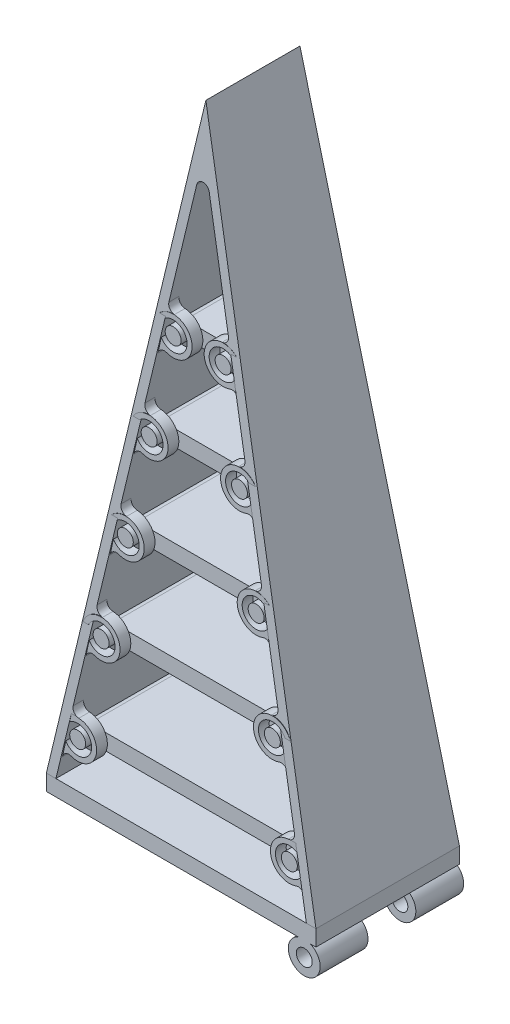
from build123d import *
from build123d.topology import SkipClean

# Parameters (mm, degrees)
AUFSATZ_LINEAR_AUSTRAGEN4_DEPTH  = 18
SCHNITT_LINEAR_START             = -33.911149
SCHNITT_LINEAR_AUSTRAGEN1_DEPTH  = 33.822298
AUFSATZ_LINEAR_START             = -5.37
AUFSATZ_LINEAR_AUSTRAGEN5_DEPTH  = 10.74
AUFSATZ_LINEAR_START_2           = -5.85
AUFSATZ_LINEAR_AUSTRAGEN6_DEPTH  = 11.7
AUFSATZ_LINEAR_START_3           = -6.3
AUFSATZ_LINEAR_AUSTRAGEN7_DEPTH  = 12.6
AUFSATZ_LINEAR_START_4           = -6.8
AUFSATZ_LINEAR_AUSTRAGEN8_DEPTH  = 13.6
AUFSATZ_LINEAR_START_5           = -7.2
AUFSATZ_LINEAR_AUSTRAGEN9_DEPTH  = 14.4
SKIZZE13_R                       = 1
AUFSATZ_LINEAR_AUSTRAGEN12_DEPTH = 1.5
SKIZZE14_R                       = 1
AUFSATZ_LINEAR_AUSTRAGEN13_DEPTH = 1.5
SKIZZE15_R                       = 1
AUFSATZ_LINEAR_AUSTRAGEN14_DEPTH = 1.5
SKIZZE16_R                       = 1
AUFSATZ_LINEAR_AUSTRAGEN15_DEPTH = 1.5
SKIZZE17_R                       = 1
AUFSATZ_LINEAR_AUSTRAGEN16_DEPTH = 1.5
SKIZZE18_R                       = 1
AUFSATZ_LINEAR_AUSTRAGEN17_DEPTH = 1.5
SKIZZE19_R                       = 1
AUFSATZ_LINEAR_AUSTRAGEN18_DEPTH = 1.5
SKIZZE20_R                       = 1
AUFSATZ_LINEAR_AUSTRAGEN19_DEPTH = 1.5
SKIZZE21_R                       = 1
AUFSATZ_LINEAR_AUSTRAGEN20_DEPTH = 1.5
SKIZZE22_R                       = 1
AUFSATZ_LINEAR_AUSTRAGEN21_DEPTH = 1.5
AUFSATZ_LINEAR_START_6           = -1.35
SKIZZE24_R                       = 2.375
SKIZZE24_R_2                     = 1.75
AUFSATZ_LINEAR_AUSTRAGEN22_DEPTH = 1.35
SKIZZE25_R                       = 2.375
SKIZZE25_R_2                     = 1.75
AUFSATZ_LINEAR_AUSTRAGEN23_DEPTH = 1.35
SKIZZE26_R                       = 2.375
SKIZZE26_R_2                     = 1.75
AUFSATZ_LINEAR_AUSTRAGEN24_DEPTH = 1.35
SKIZZE27_R                       = 2.375
SKIZZE27_R_2                     = 1.75
AUFSATZ_LINEAR_AUSTRAGEN25_DEPTH = 1.35
SKIZZE28_R                       = 2.375
SKIZZE28_R_2                     = 1.75
AUFSATZ_LINEAR_AUSTRAGEN26_DEPTH = 1.35
SKIZZE29_R                       = 2.375
SKIZZE29_R_2                     = 1.75
AUFSATZ_LINEAR_AUSTRAGEN27_DEPTH = 1.35
SKIZZE30_R                       = 2.375
SKIZZE30_R_2                     = 1.75
AUFSATZ_LINEAR_AUSTRAGEN28_DEPTH = 1.35
SKIZZE31_R                       = 2.375
SKIZZE31_R_2                     = 1.75
AUFSATZ_LINEAR_AUSTRAGEN29_DEPTH = 1.35
SKIZZE32_R                       = 2.375
SKIZZE32_R_2                     = 1.75
AUFSATZ_LINEAR_AUSTRAGEN30_DEPTH = 1.35
SKIZZE33_R                       = 2.375
SKIZZE33_R_2                     = 1.75
AUFSATZ_LINEAR_AUSTRAGEN31_DEPTH = 1.35
VERRUNDUNG1_R                    = 0.8
VERRUNDUNG2_R                    = 0.8
AUFSATZ_LINEAR_AUSTRAGEN32_DEPTH = 2
AUFSATZ_LINEAR_START_7           = -18
SKIZZE38_R                       = 2
AUFSATZ_LINEAR_AUSTRAGEN33_DEPTH = 18
SKIZZE39_R                       = 1
SCHNITT_LINEAR_AUSTRAGEN2_DEPTH  = 18
SCHNITT_LINEAR_START_2           = -12
SKIZZE40_R                       = 2
SCHNITT_LINEAR_AUSTRAGEN3_DEPTH  = 6


with BuildPart() as part:
    # Skizze1 → Aufsatz-Linear austragen4 (new body)
    with BuildSketch(Plane.XY):
        Polygon((0, 0), (16.911148858, -80), (15.711148858, -80), (0, -5.676728459), (-15.711148858, -80), (-16.911148858, -80), align=None)
    extrude(amount=AUFSATZ_LINEAR_AUSTRAGEN4_DEPTH)

    # Skizze11 → Schnitt-Linear austragen1 (cut)
    with BuildSketch(Plane(origin=(17, 0, 0), x_dir=(0, 0, -1), z_dir=(1, 0, 0)).offset(SCHNITT_LINEAR_START)):
        Polygon((-18, -80), (-14.9, 0), (-18, 0), align=None)
        Polygon((0, -80), (-3.1, 0), (0, 0), align=None)
    extrude(amount=SCHNITT_LINEAR_AUSTRAGEN1_DEPTH, mode=Mode.SUBTRACT)

    # Skizze24 → Aufsatz-Linear austragen22 (add)
    # profile 1 of 2: a face of its own
    with BuildSketch(Plane.XY.offset(15.87).offset(AUFSATZ_LINEAR_START_6)):
        with Locations((-3.132547008, -26.676728459)):
            Circle(SKIZZE24_R)
        with Locations((-3.132547008, -26.676728459)):
            Circle(SKIZZE24_R_2, mode=Mode.SUBTRACT)
    # profile 2 of 2: a face of its own
    with BuildSketch(Plane.XY.offset(15.87).offset(AUFSATZ_LINEAR_START_6)):
        with Locations((3.132547008, -26.676728459)):
            Circle(SKIZZE24_R)
        with Locations((3.132547008, -26.676728459)):
            Circle(SKIZZE24_R_2, mode=Mode.SUBTRACT)
    extrude(amount=AUFSATZ_LINEAR_AUSTRAGEN22_DEPTH)

    # Skizze25 → Aufsatz-Linear austragen23 (add)
    # profile 1 of 2: a face of its own
    with BuildSketch(Plane.XY.offset(16.35).offset(AUFSATZ_LINEAR_START_6)):
        with Locations((-5.669219336, -38.676728459)):
            Circle(SKIZZE25_R)
        with Locations((-5.669219336, -38.676728459)):
            Circle(SKIZZE25_R_2, mode=Mode.SUBTRACT)
    # profile 2 of 2: a face of its own
    with BuildSketch(Plane.XY.offset(16.35).offset(AUFSATZ_LINEAR_START_6)):
        with Locations((5.669219336, -38.676728459)):
            Circle(SKIZZE25_R)
        with Locations((5.669219336, -38.676728459)):
            Circle(SKIZZE25_R_2, mode=Mode.SUBTRACT)
    extrude(amount=AUFSATZ_LINEAR_AUSTRAGEN23_DEPTH)

    # Skizze26 → Aufsatz-Linear austragen24 (add)
    # profile 1 of 2: a face of its own
    with BuildSketch(Plane.XY.offset(16.8).offset(AUFSATZ_LINEAR_START_6)):
        with Locations((-8.205891665, -50.676728459)):
            Circle(SKIZZE26_R)
        with Locations((-8.205891665, -50.676728459)):
            Circle(SKIZZE26_R_2, mode=Mode.SUBTRACT)
    # profile 2 of 2: a face of its own
    with BuildSketch(Plane.XY.offset(16.8).offset(AUFSATZ_LINEAR_START_6)):
        with Locations((8.205891665, -50.676728459)):
            Circle(SKIZZE26_R)
        with Locations((8.205891665, -50.676728459)):
            Circle(SKIZZE26_R_2, mode=Mode.SUBTRACT)
    extrude(amount=AUFSATZ_LINEAR_AUSTRAGEN24_DEPTH)

    # Skizze27 → Aufsatz-Linear austragen25 (add)
    # profile 1 of 2: a face of its own
    with BuildSketch(Plane.XY.offset(17.3).offset(AUFSATZ_LINEAR_START_6)):
        with Locations((-10.742563994, -62.676728459)):
            Circle(SKIZZE27_R)
        with Locations((-10.742563994, -62.676728459)):
            Circle(SKIZZE27_R_2, mode=Mode.SUBTRACT)
    # profile 2 of 2: a face of its own
    with BuildSketch(Plane.XY.offset(17.3).offset(AUFSATZ_LINEAR_START_6)):
        with Locations((10.742563994, -62.676728459)):
            Circle(SKIZZE27_R)
        with Locations((10.742563994, -62.676728459)):
            Circle(SKIZZE27_R_2, mode=Mode.SUBTRACT)
    extrude(amount=AUFSATZ_LINEAR_AUSTRAGEN25_DEPTH)

    # Skizze28 → Aufsatz-Linear austragen26 (add)
    # profile 1 of 2: a face of its own
    with BuildSketch(Plane.XY.offset(17.7).offset(AUFSATZ_LINEAR_START_6)):
        with Locations((-13.279236322, -74.676728459)):
            Circle(SKIZZE28_R)
        with Locations((-13.279236322, -74.676728459)):
            Circle(SKIZZE28_R_2, mode=Mode.SUBTRACT)
    # profile 2 of 2: a face of its own
    with BuildSketch(Plane.XY.offset(17.7).offset(AUFSATZ_LINEAR_START_6)):
        with Locations((13.279236322, -74.676728459)):
            Circle(SKIZZE28_R)
        with Locations((13.279236322, -74.676728459)):
            Circle(SKIZZE28_R_2, mode=Mode.SUBTRACT)
    extrude(amount=AUFSATZ_LINEAR_AUSTRAGEN26_DEPTH)

    # Skizze29 → Aufsatz-Linear austragen27 (add)
    # profile 1 of 2: a face of its own
    with BuildSketch(Plane(origin=(0, 0, 2.13), x_dir=(-1, 0, 0), z_dir=(0, 0, -1)).offset(AUFSATZ_LINEAR_START_6)):
        with Locations((-3.132547008, -26.676728459)):
            Circle(SKIZZE29_R)
        with Locations((-3.132547008, -26.676728459)):
            Circle(SKIZZE29_R_2, mode=Mode.SUBTRACT)
    # profile 2 of 2: a face of its own
    with BuildSketch(Plane(origin=(0, 0, 2.13), x_dir=(-1, 0, 0), z_dir=(0, 0, -1)).offset(AUFSATZ_LINEAR_START_6)):
        with Locations((3.132547008, -26.676728459)):
            Circle(SKIZZE29_R)
        with Locations((3.132547008, -26.676728459)):
            Circle(SKIZZE29_R_2, mode=Mode.SUBTRACT)
    extrude(amount=AUFSATZ_LINEAR_AUSTRAGEN27_DEPTH)

    # Skizze30 → Aufsatz-Linear austragen28 (add)
    # profile 1 of 2: a face of its own
    with BuildSketch(Plane(origin=(0, 0, 1.65), x_dir=(-1, 0, 0), z_dir=(0, 0, -1)).offset(AUFSATZ_LINEAR_START_6)):
        with Locations((-5.669219336, -38.676728459)):
            Circle(SKIZZE30_R)
        with Locations((-5.669219336, -38.676728459)):
            Circle(SKIZZE30_R_2, mode=Mode.SUBTRACT)
    # profile 2 of 2: a face of its own
    with BuildSketch(Plane(origin=(0, 0, 1.65), x_dir=(-1, 0, 0), z_dir=(0, 0, -1)).offset(AUFSATZ_LINEAR_START_6)):
        with Locations((5.669219336, -38.676728459)):
            Circle(SKIZZE30_R)
        with Locations((5.669219336, -38.676728459)):
            Circle(SKIZZE30_R_2, mode=Mode.SUBTRACT)
    extrude(amount=AUFSATZ_LINEAR_AUSTRAGEN28_DEPTH)

    # Skizze31 → Aufsatz-Linear austragen29 (add)
    # profile 1 of 2: a face of its own
    with BuildSketch(Plane(origin=(0, 0, 1.2), x_dir=(-1, 0, 0), z_dir=(0, 0, -1)).offset(AUFSATZ_LINEAR_START_6)):
        with Locations((-8.205891665, -50.676728459)):
            Circle(SKIZZE31_R)
        with Locations((-8.205891665, -50.676728459)):
            Circle(SKIZZE31_R_2, mode=Mode.SUBTRACT)
    # profile 2 of 2: a face of its own
    with BuildSketch(Plane(origin=(0, 0, 1.2), x_dir=(-1, 0, 0), z_dir=(0, 0, -1)).offset(AUFSATZ_LINEAR_START_6)):
        with Locations((8.205891665, -50.676728459)):
            Circle(SKIZZE31_R)
        with Locations((8.205891665, -50.676728459)):
            Circle(SKIZZE31_R_2, mode=Mode.SUBTRACT)
    extrude(amount=AUFSATZ_LINEAR_AUSTRAGEN29_DEPTH)

    # Skizze32 → Aufsatz-Linear austragen30 (add)
    # profile 1 of 2: a face of its own
    with BuildSketch(Plane(origin=(0, 0, 0.7), x_dir=(-1, 0, 0), z_dir=(0, 0, -1)).offset(AUFSATZ_LINEAR_START_6)):
        with Locations((-10.742563994, -62.676728459)):
            Circle(SKIZZE32_R)
        with Locations((-10.742563994, -62.676728459)):
            Circle(SKIZZE32_R_2, mode=Mode.SUBTRACT)
    # profile 2 of 2: a face of its own
    with BuildSketch(Plane(origin=(0, 0, 0.7), x_dir=(-1, 0, 0), z_dir=(0, 0, -1)).offset(AUFSATZ_LINEAR_START_6)):
        with Locations((10.742563994, -62.676728459)):
            Circle(SKIZZE32_R)
        with Locations((10.742563994, -62.676728459)):
            Circle(SKIZZE32_R_2, mode=Mode.SUBTRACT)
    extrude(amount=AUFSATZ_LINEAR_AUSTRAGEN30_DEPTH)

    # Skizze33 → Aufsatz-Linear austragen31 (add)
    # profile 1 of 2: a face of its own
    with BuildSketch(Plane(origin=(0, 0, 0.3), x_dir=(-1, 0, 0), z_dir=(0, 0, -1)).offset(AUFSATZ_LINEAR_START_6)):
        with Locations((-13.279236322, -74.676728459)):
            Circle(SKIZZE33_R)
        with Locations((-13.279236322, -74.676728459)):
            Circle(SKIZZE33_R_2, mode=Mode.SUBTRACT)
    # profile 2 of 2: a face of its own
    with BuildSketch(Plane(origin=(0, 0, 0.3), x_dir=(-1, 0, 0), z_dir=(0, 0, -1)).offset(AUFSATZ_LINEAR_START_6)):
        with Locations((13.279236322, -74.676728459)):
            Circle(SKIZZE33_R)
        with Locations((13.279236322, -74.676728459)):
            Circle(SKIZZE33_R_2, mode=Mode.SUBTRACT)
    extrude(amount=AUFSATZ_LINEAR_AUSTRAGEN31_DEPTH)

    # Verrundung1
    verrundung1_edges = [part.edges().sort_by_distance(p)[0] for p in [
        (0, -5.676728459, 9),
    ]]
    fillet(verrundung1_edges, radius=VERRUNDUNG1_R)

    # Verrundung2
    # the kernel refuses this fillet: 0.8 mm, written as the material it adds along each edge
    with BuildSketch(Plane(origin=(-7.333926251, -40.370651683, 16.35), x_dir=(-0.20681895998091412, -0.9783792300495822, 0), z_dir=(0, 0, -1)), Plane(origin=(-9.87059858, -52.370651683, 16.8), x_dir=(-0.20681895998091412, -0.9783792300495822, 0), z_dir=(0, 0, -1)), Plane(origin=(-12.407270908, -64.370651683, 17.3), x_dir=(-0.2068189599809156, -0.9783792300495817, 0), z_dir=(0, 0, -1)), Plane(origin=(-14.943943237, -76.370651683, 17.7), x_dir=(-0.2068189599809131, -0.9783792300495824, 0), z_dir=(0, 0, -1)), Plane(origin=(4.797253922, -28.370651683, 2.13), x_dir=(0.20681895998091462, -0.9783792300495819, 0), z_dir=(0, 0, 1)), Plane(origin=(7.333926251, -40.370651683, 1.65), x_dir=(0.20681895998091462, -0.9783792300495819, 0), z_dir=(0, 0, 1)), Plane(origin=(9.87059858, -52.370651683, 1.2), x_dir=(0.20681895998091412, -0.9783792300495822, 0), z_dir=(0, 0, 1)), Plane(origin=(12.407270908, -64.370651683, 0.7), x_dir=(0.20681895998091412, -0.9783792300495822, 0), z_dir=(0, 0, 1)), Plane(origin=(14.943943237, -76.370651683, 0.3), x_dir=(0.20681895998091113, -0.9783792300495827, 0), z_dir=(0, 0, 1)), Plane(origin=(-4.797253922, -28.370651683, 15.87), x_dir=(-0.20681895998091177, -0.9783792300495826, 0), z_dir=(0, 0, -1))) as verrundung2_piece_1:
        with BuildLine():
            CenterArc((1.137162009, -0.8), VERRUNDUNG2_R, 90, 98.665792169)
            ThreePointArc((0.346294794, -0.920536499), (0.221320117, -0.44214625), (0, 0))
            Line((0, 0), (1.137162009, 0))
        make_face()
    extrude(amount=1.35)
    with BuildSketch(Plane(origin=(-6.505991795, -36.45401911, 19.155498263), x_dir=(0.20681895998091263, 0.9783792300495825, 0), z_dir=(0, 0, -1))) as verrundung2_piece_2_section:
        with BuildLine():
            CenterArc((1.137162009, 0.8), VERRUNDUNG2_R, 171.334207831, 98.665792169)
            ThreePointArc((0.346294794, 0.920536499), (0.221320117, 0.44214625), (0, 0))
            Line((0, 0), (1.137162009, 0))
        make_face()
    verrundung2_piece_2 = extrude(amount=4.155498263, mode=Mode.PRIVATE)
    verrundung2_piece_2 = split(verrundung2_piece_2, bisect_by=Plane(origin=(-6.217215771, -36.095589606, 16.298704097), z_dir=(0, -0.03872093994908253, -0.9992500632021294)), keep=Keep.TOP, mode=Mode.PRIVATE)
    add(verrundung2_piece_2)
    with BuildSketch(Plane(origin=(7.333926251, -40.370651683, 16.35), x_dir=(0.20681895998091462, -0.9783792300495819, 0), z_dir=(0, 0, -1)), Plane(origin=(9.87059858, -52.370651683, 16.8), x_dir=(0.20681895998091263, -0.9783792300495825, 0), z_dir=(0, 0, -1)), Plane(origin=(12.407270908, -64.370651683, 17.3), x_dir=(0.20681895998091412, -0.9783792300495822, 0), z_dir=(0, 0, -1)), Plane(origin=(14.943943237, -76.370651683, 17.7), x_dir=(0.20681895998090907, -0.9783792300495833, 0), z_dir=(0, 0, -1)), Plane(origin=(-4.797253922, -28.370651683, 2.13), x_dir=(-0.20681895998091113, -0.9783792300495827, 0), z_dir=(0, 0, 1)), Plane(origin=(-7.333926251, -40.370651683, 1.65), x_dir=(-0.2068189599809139, -0.9783792300495822, 0), z_dir=(0, 0, 1)), Plane(origin=(-9.87059858, -52.370651683, 1.2), x_dir=(-0.20681895998091412, -0.9783792300495822, 0), z_dir=(0, 0, 1)), Plane(origin=(-12.407270908, -64.370651683, 0.7), x_dir=(-0.20681895998091412, -0.9783792300495822, 0), z_dir=(0, 0, 1)), Plane(origin=(-14.943943237, -76.370651683, 0.3), x_dir=(-0.2068189599809131, -0.9783792300495824, 0), z_dir=(0, 0, 1)), Plane(origin=(4.797253922, -28.370651683, 15.87), x_dir=(0.20681895998091462, -0.9783792300495819, 0), z_dir=(0, 0, -1))) as verrundung2_piece_3:
        with BuildLine():
            CenterArc((1.137162009, 0.8), VERRUNDUNG2_R, 171.334207831, 98.665792169)
            ThreePointArc((0.346294794, 0.920536499), (0.221320117, 0.44214625), (0, 0))
            Line((0, 0), (1.137162009, 0))
        make_face()
    extrude(amount=1.35)
    with BuildSketch(Plane(origin=(6.505991795, -36.45401911, 19.155498263), x_dir=(-0.20681895998091412, 0.9783792300495822, 0), z_dir=(0, 0, -1))) as verrundung2_piece_4_section:
        with BuildLine():
            CenterArc((1.137162009, -0.8), VERRUNDUNG2_R, 90, 98.665792169)
            ThreePointArc((0.346294794, -0.920536499), (0.221320117, -0.44214625), (0, 0))
            Line((0, 0), (1.137162009, 0))
        make_face()
    verrundung2_piece_4 = extrude(amount=4.155498263, mode=Mode.PRIVATE)
    verrundung2_piece_4 = split(verrundung2_piece_4, bisect_by=Plane(origin=(6.217215771, -36.095589606, 16.298704097), z_dir=(0, -0.03872093994908253, -0.9992500632021294)), keep=Keep.TOP, mode=Mode.PRIVATE)
    add(verrundung2_piece_4)
    with BuildSketch(Plane(origin=(-9.042664124, -48.45401911, 19.620498263), x_dir=(0.20681895998091263, 0.9783792300495825, 0), z_dir=(0, 0, -1))) as verrundung2_piece_5_section:
        with BuildLine():
            CenterArc((1.137162009, 0.8), VERRUNDUNG2_R, 171.334207831, 98.665792169)
            ThreePointArc((0.346294794, 0.920536499), (0.221320117, 0.44214625), (0, 0))
            Line((0, 0), (1.137162009, 0))
        make_face()
    verrundung2_piece_5 = extrude(amount=4.170498263, mode=Mode.PRIVATE)
    verrundung2_piece_5 = split(verrundung2_piece_5, bisect_by=Plane(origin=(-8.753891259, -48.095283689, 16.763692243), z_dir=(0, -0.03872093994908253, -0.9992500632021294)), keep=Keep.TOP, mode=Mode.PRIVATE)
    add(verrundung2_piece_5)
    with BuildSketch(Plane(origin=(9.042664124, -48.45401911, 19.620498263), x_dir=(-0.20681895998091412, 0.9783792300495822, 0), z_dir=(0, 0, -1))) as verrundung2_piece_6_section:
        with BuildLine():
            CenterArc((1.137162009, -0.8), VERRUNDUNG2_R, 90, 98.665792169)
            ThreePointArc((0.346294794, -0.920536499), (0.221320117, -0.44214625), (0, 0))
            Line((0, 0), (1.137162009, 0))
        make_face()
    verrundung2_piece_6 = extrude(amount=4.170498263, mode=Mode.PRIVATE)
    verrundung2_piece_6 = split(verrundung2_piece_6, bisect_by=Plane(origin=(8.753891259, -48.095283689, 16.763692243), z_dir=(0, -0.03872093994908253, -0.9992500632021294)), keep=Keep.TOP, mode=Mode.PRIVATE)
    add(verrundung2_piece_6)
    with BuildSketch(Plane(origin=(-11.579336453, -60.45401911, 20.085498263), x_dir=(0.20681895998091412, 0.9783792300495822, 0), z_dir=(0, 0, -1))) as verrundung2_piece_7_section:
        with BuildLine():
            CenterArc((1.137162009, 0.8), VERRUNDUNG2_R, 171.334207831, 98.665792169)
            ThreePointArc((0.346294794, 0.920536499), (0.221320117, 0.44214625), (0, 0))
            Line((0, 0), (1.137162009, 0))
        make_face()
    verrundung2_piece_7 = extrude(amount=4.135498263, mode=Mode.PRIVATE)
    verrundung2_piece_7 = split(verrundung2_piece_7, bisect_by=Plane(origin=(-11.290556099, -60.095998069, 17.228719925), z_dir=(0, -0.03872093994908253, -0.9992500632021294)), keep=Keep.TOP, mode=Mode.PRIVATE)
    add(verrundung2_piece_7)
    with BuildSketch(Plane(origin=(11.579336453, -60.45401911, 20.085498263), x_dir=(-0.20681895998091435, 0.978379230049582, 0), z_dir=(0, 0, -1))) as verrundung2_piece_8_section:
        with BuildLine():
            CenterArc((1.137162009, -0.8), VERRUNDUNG2_R, 90, 98.665792169)
            ThreePointArc((0.346294794, -0.920536499), (0.221320117, -0.44214625), (0, 0))
            Line((0, 0), (1.137162009, 0))
        make_face()
    verrundung2_piece_8 = extrude(amount=4.135498263, mode=Mode.PRIVATE)
    verrundung2_piece_8 = split(verrundung2_piece_8, bisect_by=Plane(origin=(11.290556099, -60.095998069, 17.228719925), z_dir=(0, -0.03872093994908253, -0.9992500632021294)), keep=Keep.TOP, mode=Mode.PRIVATE)
    add(verrundung2_piece_8)
    with BuildSketch(Plane(origin=(-14.116008781, -72.45401911, 17.7), x_dir=(0.20681895998091412, 0.9783792300495822, 0), z_dir=(0, 0, -1))) as verrundung2_piece_9_section:
        with BuildLine():
            CenterArc((1.137162009, 0.8), VERRUNDUNG2_R, 171.334207831, 98.665792169)
            ThreePointArc((0.346294794, 0.920536499), (0.221320117, 0.44214625), (0, 0))
            Line((0, 0), (1.137162009, 0))
        make_face()
    verrundung2_piece_9 = extrude(amount=1.35, mode=Mode.PRIVATE)
    verrundung2_piece_9 = split(verrundung2_piece_9, bisect_by=Plane(origin=(-13.827218085, -72.094512866, 17.693662374), z_dir=(0, -0.03872093994908253, -0.9992500632021294)), keep=Keep.TOP, mode=Mode.PRIVATE)
    add(verrundung2_piece_9)
    with BuildSketch(Plane(origin=(14.116008781, -72.45401911, 17.7), x_dir=(-0.20681895998091662, 0.9783792300495815, 0), z_dir=(0, 0, -1))) as verrundung2_piece_10_section:
        with BuildLine():
            CenterArc((1.137162009, -0.8), VERRUNDUNG2_R, 90, 98.665792169)
            ThreePointArc((0.346294794, -0.920536499), (0.221320117, -0.44214625), (0, 0))
            Line((0, 0), (1.137162009, 0))
        make_face()
    verrundung2_piece_10 = extrude(amount=1.35, mode=Mode.PRIVATE)
    verrundung2_piece_10 = split(verrundung2_piece_10, bisect_by=Plane(origin=(13.827218085, -72.094512866, 17.693662374), z_dir=(0, -0.03872093994908253, -0.9992500632021294)), keep=Keep.TOP, mode=Mode.PRIVATE)
    add(verrundung2_piece_10)
    with BuildSketch(Plane(origin=(3.969319467, -24.45401911, -0.690498263), x_dir=(-0.20681895998091412, 0.9783792300495822, 0), z_dir=(0, 0, 1))) as verrundung2_piece_11_section:
        with BuildLine():
            CenterArc((1.137162009, 0.8), VERRUNDUNG2_R, 171.334207831, 98.665792169)
            ThreePointArc((0.346294794, 0.920536499), (0.221320117, 0.44214625), (0, 0))
            Line((0, 0), (1.137162009, 0))
        make_face()
    verrundung2_piece_11 = extrude(amount=4.170498263, mode=Mode.PRIVATE)
    verrundung2_piece_11 = split(verrundung2_piece_11, bisect_by=Plane(origin=(3.680546602, -24.095283689, 2.166307757), z_dir=(0, -0.03872093994908251, 0.9992500632021294)), keep=Keep.TOP, mode=Mode.PRIVATE)
    add(verrundung2_piece_11)
    with BuildSketch(Plane(origin=(-3.969319467, -24.45401911, -0.690498263), x_dir=(0.20681895998091285, 0.9783792300495823, 0), z_dir=(0, 0, 1))) as verrundung2_piece_12_section:
        with BuildLine():
            CenterArc((1.137162009, -0.8), VERRUNDUNG2_R, 90, 98.665792169)
            ThreePointArc((0.346294794, -0.920536499), (0.221320117, -0.44214625), (0, 0))
            Line((0, 0), (1.137162009, 0))
        make_face()
    verrundung2_piece_12 = extrude(amount=4.170498263, mode=Mode.PRIVATE)
    verrundung2_piece_12 = split(verrundung2_piece_12, bisect_by=Plane(origin=(-3.680546602, -24.095283689, 2.166307757), z_dir=(0, -0.03872093994908251, 0.9992500632021294)), keep=Keep.TOP, mode=Mode.PRIVATE)
    add(verrundung2_piece_12)
    with BuildSketch(Plane(origin=(6.505991795, -36.45401911, -1.155498263), x_dir=(-0.20681895998091537, 0.9783792300495818, 0), z_dir=(0, 0, 1))) as verrundung2_piece_13_section:
        with BuildLine():
            CenterArc((1.137162009, 0.8), VERRUNDUNG2_R, 171.334207831, 98.665792169)
            ThreePointArc((0.346294794, 0.920536499), (0.221320117, 0.44214625), (0, 0))
            Line((0, 0), (1.137162009, 0))
        make_face()
    verrundung2_piece_13 = extrude(amount=4.155498263, mode=Mode.PRIVATE)
    verrundung2_piece_13 = split(verrundung2_piece_13, bisect_by=Plane(origin=(6.217215771, -36.095589606, 1.701295903), z_dir=(0, -0.03872093994908251, 0.9992500632021294)), keep=Keep.TOP, mode=Mode.PRIVATE)
    add(verrundung2_piece_13)
    with BuildSketch(Plane(origin=(-6.505991795, -36.45401911, -1.155498263), x_dir=(0.20681895998091288, 0.9783792300495825, 0), z_dir=(0, 0, 1))) as verrundung2_piece_14_section:
        with BuildLine():
            CenterArc((1.137162009, -0.8), VERRUNDUNG2_R, 90, 98.665792169)
            ThreePointArc((0.346294794, -0.920536499), (0.221320117, -0.44214625), (0, 0))
            Line((0, 0), (1.137162009, 0))
        make_face()
    verrundung2_piece_14 = extrude(amount=4.155498263, mode=Mode.PRIVATE)
    verrundung2_piece_14 = split(verrundung2_piece_14, bisect_by=Plane(origin=(-6.217215771, -36.095589606, 1.701295903), z_dir=(0, -0.03872093994908251, 0.9992500632021294)), keep=Keep.TOP, mode=Mode.PRIVATE)
    add(verrundung2_piece_14)
    with BuildSketch(Plane(origin=(9.042664124, -48.45401911, -1.620498263), x_dir=(-0.20681895998091412, 0.9783792300495822, 0), z_dir=(0, 0, 1))) as verrundung2_piece_15_section:
        with BuildLine():
            CenterArc((1.137162009, 0.8), VERRUNDUNG2_R, 171.334207831, 98.665792169)
            ThreePointArc((0.346294794, 0.920536499), (0.221320117, 0.44214625), (0, 0))
            Line((0, 0), (1.137162009, 0))
        make_face()
    verrundung2_piece_15 = extrude(amount=4.170498263, mode=Mode.PRIVATE)
    verrundung2_piece_15 = split(verrundung2_piece_15, bisect_by=Plane(origin=(8.753891259, -48.095283689, 1.236307757), z_dir=(0, -0.03872093994908251, 0.9992500632021294)), keep=Keep.TOP, mode=Mode.PRIVATE)
    add(verrundung2_piece_15)
    with BuildSketch(Plane(origin=(-9.042664124, -48.45401911, -1.620498263), x_dir=(0.20681895998091263, 0.9783792300495825, 0), z_dir=(0, 0, 1))) as verrundung2_piece_16_section:
        with BuildLine():
            CenterArc((1.137162009, -0.8), VERRUNDUNG2_R, 90, 98.665792169)
            ThreePointArc((0.346294794, -0.920536499), (0.221320117, -0.44214625), (0, 0))
            Line((0, 0), (1.137162009, 0))
        make_face()
    verrundung2_piece_16 = extrude(amount=4.170498263, mode=Mode.PRIVATE)
    verrundung2_piece_16 = split(verrundung2_piece_16, bisect_by=Plane(origin=(-8.753891259, -48.095283689, 1.236307757), z_dir=(0, -0.03872093994908251, 0.9992500632021294)), keep=Keep.TOP, mode=Mode.PRIVATE)
    add(verrundung2_piece_16)
    with BuildSketch(Plane(origin=(11.579336453, -60.45401911, -2.085498263), x_dir=(-0.20681895998091412, 0.9783792300495822, 0), z_dir=(0, 0, 1))) as verrundung2_piece_17_section:
        with BuildLine():
            CenterArc((1.137162009, 0.8), VERRUNDUNG2_R, 171.334207831, 98.665792169)
            ThreePointArc((0.346294794, 0.920536499), (0.221320117, 0.44214625), (0, 0))
            Line((0, 0), (1.137162009, 0))
        make_face()
    verrundung2_piece_17 = extrude(amount=4.135498263, mode=Mode.PRIVATE)
    verrundung2_piece_17 = split(verrundung2_piece_17, bisect_by=Plane(origin=(11.290556099, -60.095998069, 0.771280075), z_dir=(0, -0.03872093994908251, 0.9992500632021294)), keep=Keep.TOP, mode=Mode.PRIVATE)
    add(verrundung2_piece_17)
    with BuildSketch(Plane(origin=(-11.579336453, -60.45401911, -2.085498263), x_dir=(0.2068189599809131, 0.9783792300495824, 0), z_dir=(0, 0, 1))) as verrundung2_piece_18_section:
        with BuildLine():
            CenterArc((1.137162009, -0.8), VERRUNDUNG2_R, 90, 98.665792169)
            ThreePointArc((0.346294794, -0.920536499), (0.221320117, -0.44214625), (0, 0))
            Line((0, 0), (1.137162009, 0))
        make_face()
    verrundung2_piece_18 = extrude(amount=4.135498263, mode=Mode.PRIVATE)
    verrundung2_piece_18 = split(verrundung2_piece_18, bisect_by=Plane(origin=(-11.290556099, -60.095998069, 0.771280075), z_dir=(0, -0.03872093994908251, 0.9992500632021294)), keep=Keep.TOP, mode=Mode.PRIVATE)
    add(verrundung2_piece_18)
    with BuildSketch(Plane(origin=(14.116008781, -72.45401911, 0.3), x_dir=(-0.2068189599809156, 0.9783792300495817, 0), z_dir=(0, 0, 1))) as verrundung2_piece_19_section:
        with BuildLine():
            CenterArc((1.137162009, 0.8), VERRUNDUNG2_R, 171.334207831, 98.665792169)
            ThreePointArc((0.346294794, 0.920536499), (0.221320117, 0.44214625), (0, 0))
            Line((0, 0), (1.137162009, 0))
        make_face()
    verrundung2_piece_19 = extrude(amount=1.35, mode=Mode.PRIVATE)
    verrundung2_piece_19 = split(verrundung2_piece_19, bisect_by=Plane(origin=(13.827218085, -72.094512866, 0.306337626), z_dir=(0, -0.03872093994908251, 0.9992500632021294)), keep=Keep.TOP, mode=Mode.PRIVATE)
    add(verrundung2_piece_19)
    with BuildSketch(Plane(origin=(-14.116008781, -72.45401911, 0.3), x_dir=(0.20681895998091412, 0.9783792300495822, 0), z_dir=(0, 0, 1))) as verrundung2_piece_20_section:
        with BuildLine():
            CenterArc((1.137162009, -0.8), VERRUNDUNG2_R, 90, 98.665792169)
            ThreePointArc((0.346294794, -0.920536499), (0.221320117, -0.44214625), (0, 0))
            Line((0, 0), (1.137162009, 0))
        make_face()
    verrundung2_piece_20 = extrude(amount=1.35, mode=Mode.PRIVATE)
    verrundung2_piece_20 = split(verrundung2_piece_20, bisect_by=Plane(origin=(-13.827218085, -72.094512866, 0.306337626), z_dir=(0, -0.03872093994908251, 0.9992500632021294)), keep=Keep.TOP, mode=Mode.PRIVATE)
    add(verrundung2_piece_20)
    with BuildSketch(Plane(origin=(-3.969319467, -24.45401911, 18.690498263), x_dir=(0.20681895998091285, 0.9783792300495823, 0), z_dir=(0, 0, -1))) as verrundung2_piece_21_section:
        with BuildLine():
            CenterArc((1.137162009, 0.8), VERRUNDUNG2_R, 171.334207831, 98.665792169)
            ThreePointArc((0.346294794, 0.920536499), (0.221320117, 0.44214625), (0, 0))
            Line((0, 0), (1.137162009, 0))
        make_face()
    verrundung2_piece_21 = extrude(amount=4.170498263, mode=Mode.PRIVATE)
    verrundung2_piece_21 = split(verrundung2_piece_21, bisect_by=Plane(origin=(-3.680546602, -24.095283689, 15.833692243), z_dir=(0, -0.03872093994908253, -0.9992500632021294)), keep=Keep.TOP, mode=Mode.PRIVATE)
    add(verrundung2_piece_21)
    with BuildSketch(Plane(origin=(3.969319467, -24.45401911, 18.690498263), x_dir=(-0.20681895998091412, 0.9783792300495822, 0), z_dir=(0, 0, -1))) as verrundung2_piece_22_section:
        with BuildLine():
            CenterArc((1.137162009, -0.8), VERRUNDUNG2_R, 90, 98.665792169)
            ThreePointArc((0.346294794, -0.920536499), (0.221320117, -0.44214625), (0, 0))
            Line((0, 0), (1.137162009, 0))
        make_face()
    verrundung2_piece_22 = extrude(amount=4.170498263, mode=Mode.PRIVATE)
    verrundung2_piece_22 = split(verrundung2_piece_22, bisect_by=Plane(origin=(3.680546602, -24.095283689, 15.833692243), z_dir=(0, -0.03872093994908253, -0.9992500632021294)), keep=Keep.TOP, mode=Mode.PRIVATE)
    add(verrundung2_piece_22)

    # Skizze37 → Aufsatz-Linear austragen32 (add)
    with BuildSketch(Plane.XZ.offset(80)):
        Polygon((-16.911148858, 0), (-15.711148858, 0), (16.911148858, 0), (16.911148858, 18), (-16.911148858, 18), align=None)
    extrude(amount=AUFSATZ_LINEAR_AUSTRAGEN32_DEPTH)

    # Skizze38 → Aufsatz-Linear austragen33 (add)
    with BuildSketch(Plane.XY.offset(18).offset(AUFSATZ_LINEAR_START_7)):
        with Locations((15.441377829, -83.85395926)):
            Circle(SKIZZE38_R)
    extrude(amount=AUFSATZ_LINEAR_AUSTRAGEN33_DEPTH)

    # Skizze39 → Schnitt-Linear austragen2 (cut)
    with BuildSketch(Plane.XY.offset(18)):
        with Locations((15.441377829, -83.85395926)):
            Circle(SKIZZE39_R)
    extrude(amount=-SCHNITT_LINEAR_AUSTRAGEN2_DEPTH, mode=Mode.SUBTRACT)

    # Skizze40 → Schnitt-Linear austragen3 (cut)
    with BuildSketch(Plane.XY.offset(18).offset(SCHNITT_LINEAR_START_2)):
        with Locations((15.441377829, -83.85395926)):
            Circle(SKIZZE40_R)
    extrude(amount=SCHNITT_LINEAR_AUSTRAGEN3_DEPTH, mode=Mode.SUBTRACT)


with BuildPart() as body_2:
    # Skizze6 → Aufsatz-Linear austragen5 (new body)
    with BuildSketch(Plane.XY.offset(9).offset(AUFSATZ_LINEAR_START)):
        with BuildLine():
            Line((3.132547008, -25.676728459), (-3.132547008, -25.676728459))
            ThreePointArc((-3.132547008, -25.676728459), (-4.132547008, -26.676728459), (-3.132547008, -27.676728459))
            Line((-3.132547008, -27.676728459), (3.132547008, -27.676728459))
            ThreePointArc((3.132547008, -27.676728459), (4.132547008, -26.676728459), (3.132547008, -25.676728459))
        make_face()
    extrude(amount=AUFSATZ_LINEAR_AUSTRAGEN5_DEPTH)

    # Skizze13 → Aufsatz-Linear austragen12 (add)
    with BuildSketch(Plane.XY.offset(14.37)):
        with Locations((-3.132547008, -26.676728459)):
            Circle(SKIZZE13_R)
        with Locations((3.132547008, -26.676728459)):
            Circle(SKIZZE13_R)
    extrude(amount=AUFSATZ_LINEAR_AUSTRAGEN12_DEPTH)

    # Skizze18 → Aufsatz-Linear austragen17 (add)
    with SkipClean():  # the faces are left unmerged after this step: merging them gives an invalid solid
        with BuildSketch(Plane(origin=(0, 0, 3.63), x_dir=(-1, 0, 0), z_dir=(0, 0, -1))):
            with Locations(Location((-3.132547008, -26.676728459, 0), (0, 0, 180))):
                Circle(SKIZZE18_R)
            with Locations(Location((3.132547008, -26.676728459, 0), (0, 0, 180))):
                Circle(SKIZZE18_R)
        extrude(amount=AUFSATZ_LINEAR_AUSTRAGEN17_DEPTH)


with BuildPart() as body_3:
    # Skizze7 → Aufsatz-Linear austragen6 (new body)
    with BuildSketch(Plane.XY.offset(9).offset(AUFSATZ_LINEAR_START_2)):
        with BuildLine():
            Line((5.669219336, -37.676728459), (-5.669219336, -37.676728459))
            ThreePointArc((-5.669219336, -37.676728459), (-6.669219336, -38.676728459), (-5.669219336, -39.676728459))
            Line((-5.669219336, -39.676728459), (5.669219336, -39.676728459))
            ThreePointArc((5.669219336, -39.676728459), (6.669219336, -38.676728459), (5.669219336, -37.676728459))
        make_face()
    extrude(amount=AUFSATZ_LINEAR_AUSTRAGEN6_DEPTH)

    # Skizze14 → Aufsatz-Linear austragen13 (add)
    with BuildSketch(Plane.XY.offset(14.85)):
        with Locations((-5.669219336, -38.676728459)):
            Circle(SKIZZE14_R)
        with Locations((5.669219336, -38.676728459)):
            Circle(SKIZZE14_R)
    extrude(amount=AUFSATZ_LINEAR_AUSTRAGEN13_DEPTH)

    # Skizze19 → Aufsatz-Linear austragen18 (add)
    with SkipClean():  # the faces are left unmerged after this step: merging them gives an invalid solid
        with BuildSketch(Plane(origin=(0, 0, 3.15), x_dir=(-1, 0, 0), z_dir=(0, 0, -1))):
            with Locations(Location((-5.669219336, -38.676728459, 0), (0, 0, 180))):
                Circle(SKIZZE19_R)
            with Locations(Location((5.669219336, -38.676728459, 0), (0, 0, 180))):
                Circle(SKIZZE19_R)
        extrude(amount=AUFSATZ_LINEAR_AUSTRAGEN18_DEPTH)


with BuildPart() as body_4:
    # Skizze8 → Aufsatz-Linear austragen7 (new body)
    with BuildSketch(Plane.XY.offset(9).offset(AUFSATZ_LINEAR_START_3)):
        with BuildLine():
            Line((8.205891665, -49.676728459), (-8.205891665, -49.676728459))
            ThreePointArc((-8.205891665, -49.676728459), (-9.205891665, -50.676728459), (-8.205891665, -51.676728459))
            Line((-8.205891665, -51.676728459), (8.205891665, -51.676728459))
            ThreePointArc((8.205891665, -51.676728459), (9.205891665, -50.676728459), (8.205891665, -49.676728459))
        make_face()
    extrude(amount=AUFSATZ_LINEAR_AUSTRAGEN7_DEPTH)

    # Skizze15 → Aufsatz-Linear austragen14 (add)
    with BuildSketch(Plane.XY.offset(15.3)):
        with Locations((-8.205891665, -50.676728459)):
            Circle(SKIZZE15_R)
        with Locations((8.205891665, -50.676728459)):
            Circle(SKIZZE15_R)
    extrude(amount=AUFSATZ_LINEAR_AUSTRAGEN14_DEPTH)

    # Skizze20 → Aufsatz-Linear austragen19 (add)
    with BuildSketch(Plane(origin=(0, 0, 2.7), x_dir=(-1, 0, 0), z_dir=(0, 0, -1))):
        with Locations(Location((-8.205891665, -50.676728459, 0), (0, 0, 180))):
            Circle(SKIZZE20_R)
        with Locations(Location((8.205891665, -50.676728459, 0), (0, 0, 180))):
            Circle(SKIZZE20_R)
    extrude(amount=AUFSATZ_LINEAR_AUSTRAGEN19_DEPTH)


with BuildPart() as body_5:
    # Skizze9 → Aufsatz-Linear austragen8 (new body)
    with BuildSketch(Plane.XY.offset(9).offset(AUFSATZ_LINEAR_START_4)):
        with BuildLine():
            Line((10.742563994, -61.676728459), (-10.742563994, -61.676728459))
            ThreePointArc((-10.742563994, -61.676728459), (-11.742563994, -62.676728459), (-10.742563994, -63.676728459))
            Line((-10.742563994, -63.676728459), (10.742563994, -63.676728459))
            ThreePointArc((10.742563994, -63.676728459), (11.742563994, -62.676728459), (10.742563994, -61.676728459))
        make_face()
    extrude(amount=AUFSATZ_LINEAR_AUSTRAGEN8_DEPTH)

    # Skizze16 → Aufsatz-Linear austragen15 (add)
    with BuildSketch(Plane.XY.offset(15.8)):
        with Locations((-10.742563994, -62.676728459)):
            Circle(SKIZZE16_R)
        with Locations((10.742563994, -62.676728459)):
            Circle(SKIZZE16_R)
    extrude(amount=AUFSATZ_LINEAR_AUSTRAGEN15_DEPTH)

    # Skizze21 → Aufsatz-Linear austragen20 (add)
    with BuildSketch(Plane(origin=(0, 0, 2.2), x_dir=(-1, 0, 0), z_dir=(0, 0, -1))):
        with Locations(Location((-10.742563994, -62.676728459, 0), (0, 0, 180))):
            Circle(SKIZZE21_R)
        with Locations(Location((10.742563994, -62.676728459, 0), (0, 0, 180))):
            Circle(SKIZZE21_R)
    extrude(amount=AUFSATZ_LINEAR_AUSTRAGEN20_DEPTH)


with BuildPart() as body_6:
    # Skizze10 → Aufsatz-Linear austragen9 (new body)
    with BuildSketch(Plane.XY.offset(9).offset(AUFSATZ_LINEAR_START_5)):
        with BuildLine():
            Line((13.279236322, -73.676728459), (-13.279236322, -73.676728459))
            ThreePointArc((-13.279236322, -73.676728459), (-14.279236322, -74.676728459), (-13.279236322, -75.676728459))
            Line((-13.279236322, -75.676728459), (13.279236322, -75.676728459))
            ThreePointArc((13.279236322, -75.676728459), (14.279236322, -74.676728459), (13.279236322, -73.676728459))
        make_face()
    extrude(amount=AUFSATZ_LINEAR_AUSTRAGEN9_DEPTH)

    # Skizze17 → Aufsatz-Linear austragen16 (add)
    with BuildSketch(Plane.XY.offset(16.2)):
        with Locations((-13.279236322, -74.676728459)):
            Circle(SKIZZE17_R)
        with Locations((13.279236322, -74.676728459)):
            Circle(SKIZZE17_R)
    extrude(amount=AUFSATZ_LINEAR_AUSTRAGEN16_DEPTH)

    # Skizze22 → Aufsatz-Linear austragen21 (add)
    with SkipClean():  # the faces are left unmerged after this step: merging them gives an invalid solid
        with BuildSketch(Plane(origin=(0, 0, 1.8), x_dir=(-1, 0, 0), z_dir=(0, 0, -1))):
            with Locations(Location((-13.279236322, -74.676728459, 0), (0, 0, 180))):
                Circle(SKIZZE22_R)
            with Locations(Location((13.279236322, -74.676728459, 0), (0, 0, 180))):
                Circle(SKIZZE22_R)
        extrude(amount=AUFSATZ_LINEAR_AUSTRAGEN21_DEPTH)


solid = Compound([part.part, body_2.part, body_3.part, body_4.part, body_5.part, body_6.part])
